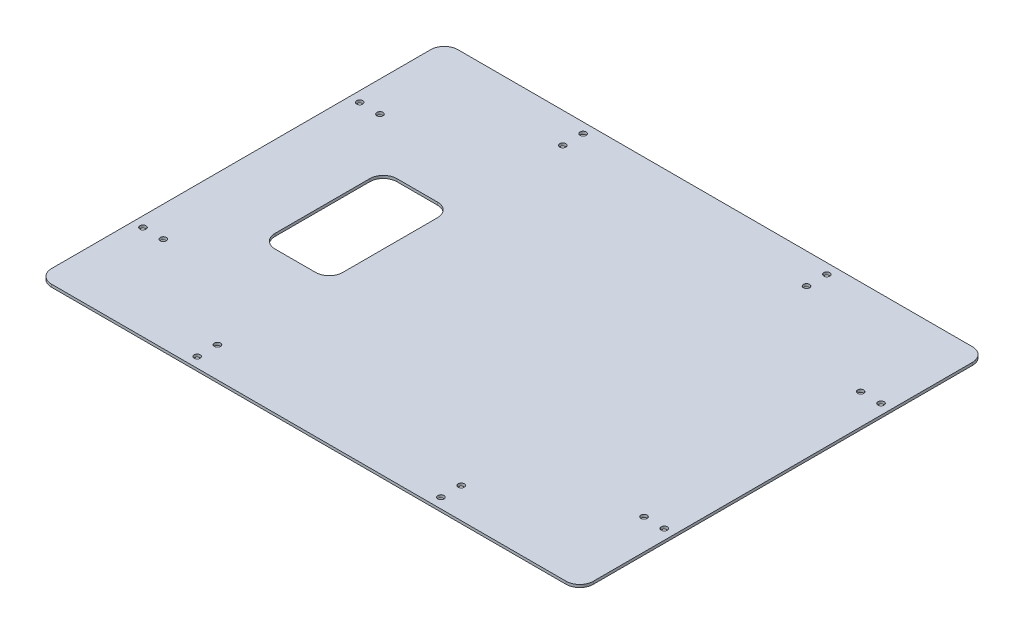
from build123d import *

# Parameters (mm, degrees)
SKETCH5_W            = 400
SKETCH5_H            = 300
BOSS_EXTRUDE1_DEPTH  = 2
FILLET1_R            = 10
CUT_EXTRUDE1_DEPTH   = 501.003999984
M4_CLEARANCE_HOLE1_D = 4.5


with BuildPart() as part:
    # Sketch5 → Boss-Extrude1 (new body)
    with BuildSketch(Plane(origin=(0, 0, 0), x_dir=(1, 0, 0), z_dir=(0, 1, 0))):
        with Locations((200, 150)):
            Rectangle(SKETCH5_W, SKETCH5_H)
    extrude(amount=BOSS_EXTRUDE1_DEPTH)

    # Fillet1
    fillet1_edges = [part.edges().sort_by_distance(p)[0] for p in [
        (0, 1, -300),
        (400, 1, -300),
        (400, 1, 0),
        (0, 1, 0),
    ]]
    fillet(fillet1_edges, radius=FILLET1_R)

    # Sketch6 → Cut-Extrude1 (cut, through all)
    with BuildSketch(Plane(origin=(0, 2, 0), x_dir=(1, 0, 0), z_dir=(0, 1, 0))):
        with BuildLine():
            Line((70, 195), (100, 195))
            ThreePointArc((100, 195), (107.071067812, 192.071067812), (110, 185))
            Line((110, 185), (110, 115))
            ThreePointArc((110, 115), (107.071067812, 107.928932188), (100, 105))
            Line((100, 105), (70, 105))
            ThreePointArc((70, 105), (62.928932188, 107.928932188), (60, 115))
            Line((60, 115), (60, 185))
            ThreePointArc((60, 185), (62.928932188, 192.071067812), (70, 195))
        make_face()
    extrude(amount=-CUT_EXTRUDE1_DEPTH, mode=Mode.SUBTRACT)

    # M4 Clearance Hole1 (through all)
    with Locations(Plane(origin=(0, 2, 0), x_dir=(1, 0, 0), z_dir=(0, 1, 0))):
        with Locations((110, 7.5), (110, 22.5), (7.5, 70), (22.5, 70), (290, 7.5), (290, 22.5), (377.5, 70), (392.5, 70), (392.5, 230), (377.5, 230), (290, 292.5), (290, 277.5), (110, 292.5), (110, 277.5), (22.5, 230), (7.5, 230)):
            Hole(M4_CLEARANCE_HOLE1_D / 2)


solid = part.part
